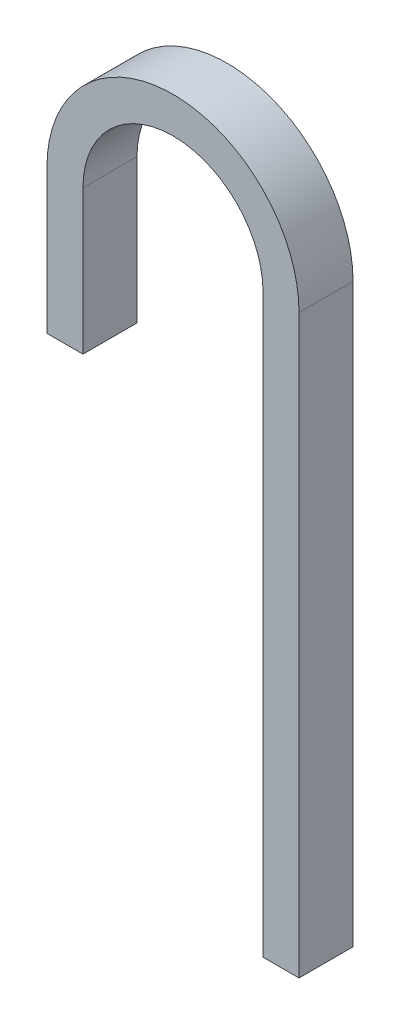
from build123d import *

# Parameters (mm, degrees)
BOSS_EXTRUDE1_DEPTH = 19.05


with BuildPart() as part:
    # Sketch5 → Boss-Extrude1 (new body)
    with BuildSketch(Plane.XY):
        with BuildLine():
            Line((0, 0), (12.7, 0))
            Line((12.7, 0), (12.7, 203.2))
            ThreePointArc((12.7, 203.2), (-31.75, 247.65), (-76.2, 203.2))
            Line((-76.2, 203.2), (-76.2, 152.4))
            Line((-76.2, 152.4), (-63.5, 152.4))
            Line((-63.5, 152.4), (-63.5, 203.2))
            ThreePointArc((-63.5, 203.2), (-31.75, 234.95), (0, 203.2))
            Line((0, 203.2), (0, 0))
        make_face()
    extrude(amount=BOSS_EXTRUDE1_DEPTH)


solid = part.part
